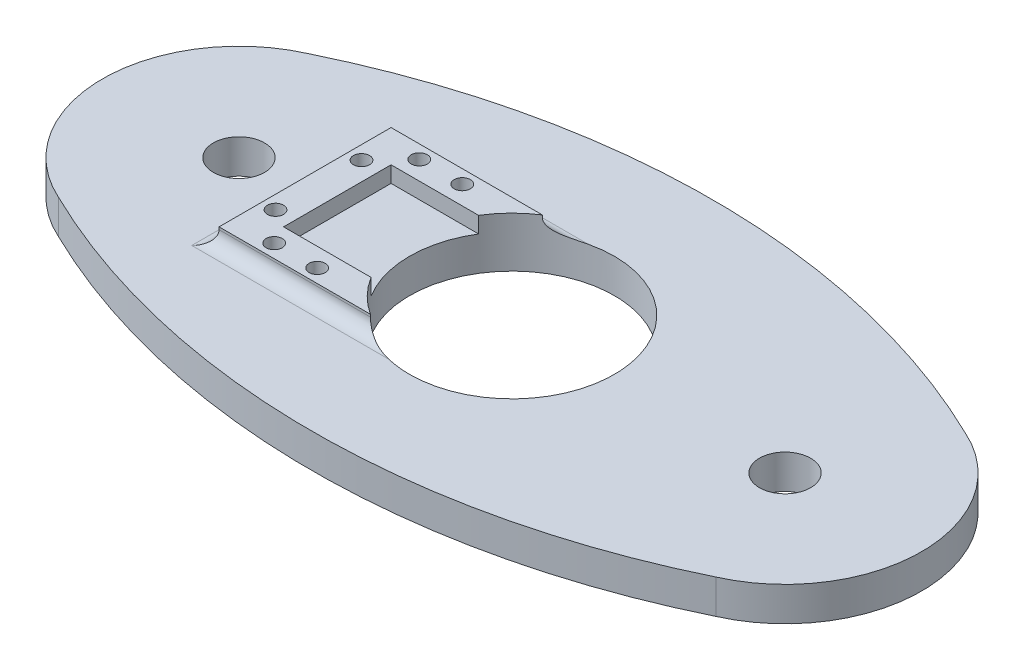
from build123d import *
from build123d.topology import SkipClean

# Parameters (mm, degrees)
SKETCH1_R           = 76.2
BOSS_EXTRUDE1_DEPTH = 6.35
CUT_EXTRUDE2_START  = -6.35
SKETCH2_R           = 4.7625
SKETCH2_R_2         = 19.05
CUT_EXTRUDE2_DEPTH  = 6.35
BOSS_EXTRUDE2_DEPTH = 3
SKETCH4_R           = 1.5
SKETCH4_R_2         = 1.25
CUT_EXTRUDE3_DEPTH  = 86.348763
FILLET1_R           = 2.54
SKETCH5_R           = 2.5
CUT_EXTRUDE4_DEPTH  = 2.85


with BuildPart() as part:
    # Sketch1 → Boss-Extrude1 (new body)
    with BuildSketch(Plane(origin=(0, 0, 0), x_dir=(1, 0, 0), z_dir=(0, 1, 0))):
        with Locations(Location((0, 0, 0), (0, 0, 270))):
            Circle(SKETCH1_R)
    extrude(amount=BOSS_EXTRUDE1_DEPTH)

    # Sketch2 → Cut-Extrude2 (cut)
    with BuildSketch(Plane(origin=(0, 6.35, 0), x_dir=(1, 0, 0), z_dir=(0, 1, 0)).offset(CUT_EXTRUDE2_START)):
        with BuildLine():
            ThreePointArc((61.150771, -23.195291), (0, -37.290064), (-61.150771, -23.195291))
            ThreePointArc((-61.150771, -23.195291), (-72.108092, -13.824804), (-76.2, 0))
            ThreePointArc((-76.2, 0), (0, -76.2), (76.2, 0))
            ThreePointArc((76.2, 0), (72.108092, -13.824804), (61.150771, -23.195291))
        make_face()
        with BuildLine():
            ThreePointArc((-61.150771, 23.195291), (0, 37.290064), (61.150771, 23.195291))
            ThreePointArc((61.150771, 23.195291), (72.108092, 13.824804), (76.2, 0))
            ThreePointArc((76.2, 0), (0, 76.2), (-76.2, 0))
            ThreePointArc((-76.2, 0), (-72.108092, 13.824804), (-61.150771, 23.195291))
        make_face()
        with Locations(Location((-50.8, 0, 0), (0, 0, 270))):
            Circle(SKETCH2_R)
        with Locations(Location((50.8, 0, 0), (0, 0, 270))):
            Circle(SKETCH2_R)
        with Locations(Location((0, 0, 0), (0, 0, 270))):
            Circle(SKETCH2_R_2)
    extrude(amount=CUT_EXTRUDE2_DEPTH, mode=Mode.SUBTRACT)

    # Sketch3 → Boss-Extrude2 (add)
    with SkipClean():  # the faces are left unmerged after this step: merging them gives an invalid solid
        with BuildSketch(Plane(origin=(0, 6.35, 0), x_dir=(1, 0, 0), z_dir=(0, 1, 0))):
            with BuildLine():
                Line((-38.5, 4.75), (-38.5, -4.75))
                Line((-38.5, -4.75), (-38.5, -11.25))
                Line((-38.5, -11.25), (-38.5, -16))
                Line((-38.5, -16), (-18, -16))
                Line((-18, -16), (-11.5, -16))
                Line((-11.5, -16), (-10.339367, -16))
                ThreePointArc((-10.339367, -16), (-13.611535, -13.327739), (-16.214268, -10))
                Line((-16.214268, -10), (-31.096327, -10))
                Line((-31.096327, -10), (-32.5, -10))
                Line((-32.5, -10), (-32.5, -8.522949))
                Line((-32.5, -8.522949), (-32.5, 8.425596))
                Line((-32.5, 8.425596), (-32.5, 10))
                Line((-32.5, 10), (-31.027855, 10))
                Line((-31.027855, 10), (-16.214268, 10))
                ThreePointArc((-16.214268, 10), (-13.611535, 13.327739), (-10.339367, 16))
                Line((-10.339367, 16), (-11.5, 16))
                Line((-11.5, 16), (-18, 16))
                Line((-18, 16), (-38.5, 16))
                Line((-38.5, 16), (-38.5, 11.25))
                Line((-38.5, 11.25), (-38.5, 4.75))
            make_face()
        extrude(amount=BOSS_EXTRUDE2_DEPTH)

    # Sketch4 → Cut-Extrude3 (cut, through all)
    # profile 1 of 12: a face of its own
    with SkipClean():  # the faces are left unmerged after this step: merging them gives an invalid solid
        with BuildSketch(Plane(origin=(0, 9.35, 0), x_dir=(1, 0, 0), z_dir=(0, 1, 0))):
            with Locations(Location((-30.75, -13.5, 0), (0, 0, 270))):
                Circle(SKETCH4_R)
            with Locations((-30.75, -13.5)):
                Circle(SKETCH4_R_2, mode=Mode.SUBTRACT)
        # profile 2 of 12: a face of its own
        with BuildSketch(Plane(origin=(0, 9.35, 0), x_dir=(1, 0, 0), z_dir=(0, 1, 0))):
            with Locations((-30.75, -13.5)):
                Circle(SKETCH4_R_2)
        # profile 3 of 12: a face of its own
        with BuildSketch(Plane(origin=(0, 9.35, 0), x_dir=(1, 0, 0), z_dir=(0, 1, 0))):
            with Locations(Location((-22.75, -13.5, 0), (0, 0, 270))):
                Circle(SKETCH4_R)
            with Locations((-22.75, -13.5)):
                Circle(SKETCH4_R_2, mode=Mode.SUBTRACT)
        # profile 4 of 12: a face of its own
        with BuildSketch(Plane(origin=(0, 9.35, 0), x_dir=(1, 0, 0), z_dir=(0, 1, 0))):
            with Locations((-22.75, -13.5)):
                Circle(SKETCH4_R_2)
        # profile 5 of 12: a face of its own
        with BuildSketch(Plane(origin=(0, 9.35, 0), x_dir=(1, 0, 0), z_dir=(0, 1, 0))):
            with Locations(Location((-36, -8, 0), (0, 0, 270))):
                Circle(SKETCH4_R)
            with Locations((-36, -8)):
                Circle(SKETCH4_R_2, mode=Mode.SUBTRACT)
        # profile 6 of 12: a face of its own
        with BuildSketch(Plane(origin=(0, 9.35, 0), x_dir=(1, 0, 0), z_dir=(0, 1, 0))):
            with Locations((-36, -8)):
                Circle(SKETCH4_R_2)
        # profile 7 of 12: a face of its own
        with BuildSketch(Plane(origin=(0, 9.35, 0), x_dir=(1, 0, 0), z_dir=(0, 1, 0))):
            with Locations(Location((-36, 8, 0), (0, 0, 270))):
                Circle(SKETCH4_R)
            with Locations((-36, 8)):
                Circle(SKETCH4_R_2, mode=Mode.SUBTRACT)
        # profile 8 of 12: a face of its own
        with BuildSketch(Plane(origin=(0, 9.35, 0), x_dir=(1, 0, 0), z_dir=(0, 1, 0))):
            with Locations((-36, 8)):
                Circle(SKETCH4_R_2)
        # profile 9 of 12: a face of its own
        with BuildSketch(Plane(origin=(0, 9.35, 0), x_dir=(1, 0, 0), z_dir=(0, 1, 0))):
            with Locations(Location((-30.75, 13.5, 0), (0, 0, 270))):
                Circle(SKETCH4_R)
            with Locations((-30.75, 13.5)):
                Circle(SKETCH4_R_2, mode=Mode.SUBTRACT)
        # profile 10 of 12: a face of its own
        with BuildSketch(Plane(origin=(0, 9.35, 0), x_dir=(1, 0, 0), z_dir=(0, 1, 0))):
            with Locations((-30.75, 13.5)):
                Circle(SKETCH4_R_2)
        # profile 11 of 12: a face of its own
        with BuildSketch(Plane(origin=(0, 9.35, 0), x_dir=(1, 0, 0), z_dir=(0, 1, 0))):
            with Locations(Location((-22.75, 13.5, 0), (0, 0, 270))):
                Circle(SKETCH4_R)
            with Locations((-22.75, 13.5)):
                Circle(SKETCH4_R_2, mode=Mode.SUBTRACT)
        # profile 12 of 12: a face of its own
        with BuildSketch(Plane(origin=(0, 9.35, 0), x_dir=(1, 0, 0), z_dir=(0, 1, 0))):
            with Locations((-22.75, 13.5)):
                Circle(SKETCH4_R_2)
        extrude(amount=-CUT_EXTRUDE3_DEPTH, mode=Mode.SUBTRACT)

    # Fillet1
    # the kernel refuses this fillet: 2.54 mm, written as the material it adds along each edge
    with BuildSketch(Plane(origin=(-3.989367, 6.35, -16), x_dir=(0, 0, -1), z_dir=(-1, 0, 0))) as fillet1_piece_1_section:
        with BuildLine():
            CenterArc((FILLET1_R, -FILLET1_R), FILLET1_R, 90, 90)
            Line((0, -FILLET1_R), (0, 0))
            Line((0, 0), (FILLET1_R, 0))
        make_face()
    fillet1_piece_1 = extrude(amount=34.510633, mode=Mode.PRIVATE)
    fillet1_piece_1 = fillet1_piece_1 - Plane(origin=(0, 6.913548, 0), x_dir=(0, 0, 1), z_dir=(0, -1, 0)) * Cylinder(19.05, 80, mode=Mode.PRIVATE)
    add(fillet1_piece_1)
    with BuildSketch(Plane(origin=(-38.5, 6.35, 16), x_dir=(0, 0, 1), z_dir=(1, 0, 0))) as fillet1_piece_2_section:
        with BuildLine():
            CenterArc((FILLET1_R, -FILLET1_R), FILLET1_R, 90, 90)
            Line((0, -FILLET1_R), (0, 0))
            Line((0, 0), (FILLET1_R, 0))
        make_face()
    fillet1_piece_2 = extrude(amount=34.510633, mode=Mode.PRIVATE)
    fillet1_piece_2 = fillet1_piece_2 - Plane(origin=(0, 6.913549, 0), x_dir=(0, 0, 1), z_dir=(0, -1, 0)) * Cylinder(19.05, 80, mode=Mode.PRIVATE)
    add(fillet1_piece_2)
    with BuildSketch(Plane(origin=(-38.5, 6.35, -16), x_dir=(-1, 0, 0), z_dir=(0, 0, 1))) as fillet1_piece_3:
        with BuildLine():
            CenterArc((FILLET1_R, -FILLET1_R), FILLET1_R, 90, 90)
            Line((0, -FILLET1_R), (0, 0))
            Line((0, 0), (FILLET1_R, 0))
        make_face()
    extrude(amount=32)
    with BuildSketch(Plane(origin=(-3.989367, 6.35, -16), x_dir=(0, 0, -1), z_dir=(-1, 0, 0))) as fillet1_piece_4a_section:
        with BuildLine():
            CenterArc((FILLET1_R, -FILLET1_R), FILLET1_R, 90, 90)
            Line((0, -FILLET1_R), (0, 0))
            Line((0, 0), (FILLET1_R, 0))
        make_face()
    fillet1_piece_4a = extrude(amount=40.860633, mode=Mode.PRIVATE)
    fillet1_piece_4a = split(fillet1_piece_4a, bisect_by=Plane(origin=(-38.5, 6.925044, -16.575044), z_dir=(-1, 0, 0)), keep=Keep.TOP, mode=Mode.PRIVATE)
    with BuildSketch(Plane(origin=(-38.5, 6.35, -22.35), x_dir=(-1, 0, 0), z_dir=(0, 0, 1))) as fillet1_piece_4b_section:
        with BuildLine():
            CenterArc((FILLET1_R, -FILLET1_R), FILLET1_R, 90, 90)
            Line((0, -FILLET1_R), (0, 0))
            Line((0, 0), (FILLET1_R, 0))
        make_face()
    fillet1_piece_4b = extrude(amount=38.35, mode=Mode.PRIVATE)
    fillet1_piece_4b = split(fillet1_piece_4b, bisect_by=Plane(origin=(-39.075044, 6.925044, -16), z_dir=(0, 0, -1)), keep=Keep.TOP, mode=Mode.PRIVATE)
    fillet1_piece_4 = fillet1_piece_4a & fillet1_piece_4b
    add(fillet1_piece_4)
    with BuildSketch(Plane(origin=(-38.5, 6.35, -16), x_dir=(-1, 0, 0), z_dir=(0, 0, 1))) as fillet1_piece_5a_section:
        with BuildLine():
            CenterArc((FILLET1_R, -FILLET1_R), FILLET1_R, 90, 90)
            Line((0, -FILLET1_R), (0, 0))
            Line((0, 0), (FILLET1_R, 0))
        make_face()
    fillet1_piece_5a = extrude(amount=38.35, mode=Mode.PRIVATE)
    fillet1_piece_5a = split(fillet1_piece_5a, bisect_by=Plane(origin=(-39.075044, 6.925044, 16), z_dir=(0, 0, 1)), keep=Keep.TOP, mode=Mode.PRIVATE)
    with BuildSketch(Plane(origin=(-44.85, 6.35, 16), x_dir=(0, 0, 1), z_dir=(1, 0, 0))) as fillet1_piece_5b_section:
        with BuildLine():
            CenterArc((FILLET1_R, -FILLET1_R), FILLET1_R, 90, 90)
            Line((0, -FILLET1_R), (0, 0))
            Line((0, 0), (FILLET1_R, 0))
        make_face()
    fillet1_piece_5b = extrude(amount=40.860633, mode=Mode.PRIVATE)
    fillet1_piece_5b = split(fillet1_piece_5b, bisect_by=Plane(origin=(-38.5, 6.925044, 16.575044), z_dir=(-1, 0, 0)), keep=Keep.TOP, mode=Mode.PRIVATE)
    fillet1_piece_5 = fillet1_piece_5a & fillet1_piece_5b
    add(fillet1_piece_5)

    # Sketch5 → Cut-Extrude4 (cut)
    with BuildSketch(Plane.XZ):
        with Locations(Location((-22.75, 13.5, 0), (0, 0, 270))):
            Circle(SKETCH5_R)
        with Locations(Location((-30.75, 13.5, 0), (0, 0, 270))):
            Circle(SKETCH5_R)
        with Locations(Location((-36, 8, 0), (0, 0, 270))):
            Circle(SKETCH5_R)
        with Locations(Location((-36, -8, 0), (0, 0, 270))):
            Circle(SKETCH5_R)
        with Locations(Location((-30.75, -13.5, 0), (0, 0, 270))):
            Circle(SKETCH5_R)
        with Locations(Location((-22.75, -13.5, 0), (0, 0, 270))):
            Circle(SKETCH5_R)
    extrude(amount=-CUT_EXTRUDE4_DEPTH, mode=Mode.SUBTRACT)


solid = part.part
